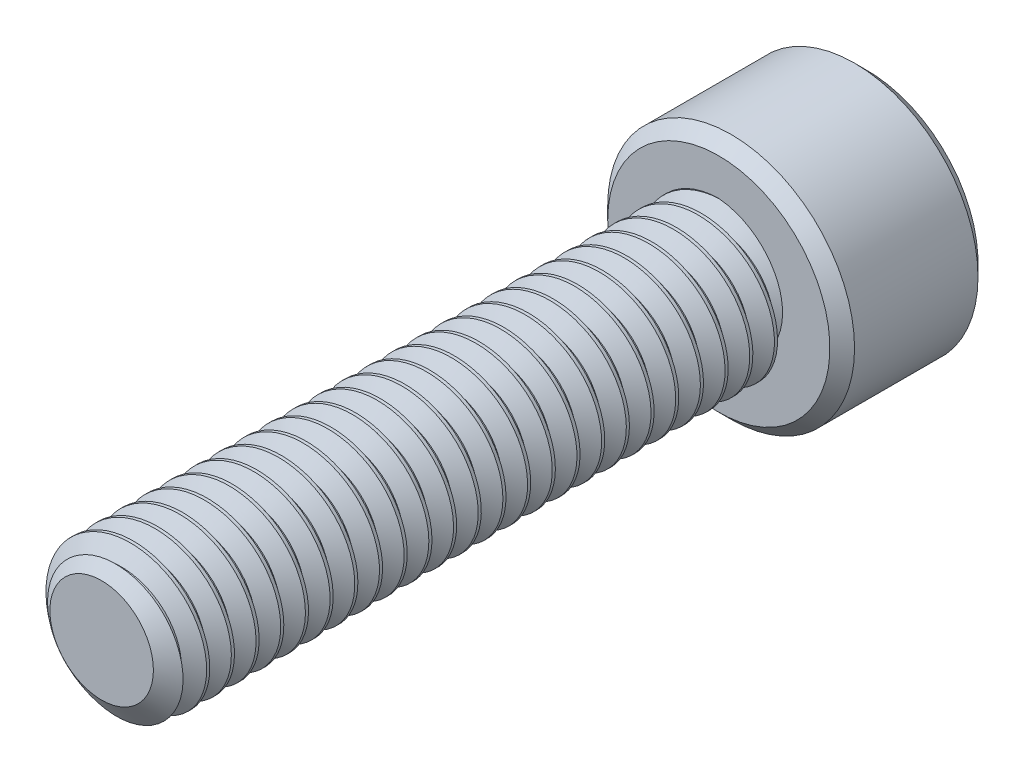
from build123d import *

# Parameters (mm, degrees)
SKETCH1_R          = 3
EXTRUDE1_DEPTH     = 25
CUT_SWEEP1_PITCH   = 1
SKETCH6_R          = 5
EXTRUDE2_DEPTH     = 6
CUT_EXTRUDE1_DEPTH = 3.75
CHAMFER1_SIZE      = 0.5


with BuildPart() as part:
    # Sketch1 → Extrude1 (new body)
    with BuildSketch(Plane.XY):
        Circle(SKETCH1_R)
    extrude(amount=-EXTRUDE1_DEPTH)

    # Cut-Sweep1: the profile of Sketch3 profile screwed along a right-hand helix of 26 turns, 6 arcs to a turn; built about Z, then put on its axis
    cut_sweep1_z = Axis((0, 0, 0), (0, 0, 1))
    cut_sweep1_corners = [(3.0003, 0, -0.875173205), (2.350480947, 0, -0.5), (2.350480947, 0, -0.375), (3.0003, 0, 0.000173205)]
    with BuildLine(mode=Mode.PRIVATE) as cut_sweep1_profile:
        Line(cut_sweep1_corners[0], cut_sweep1_corners[1])
        Line(cut_sweep1_corners[1], cut_sweep1_corners[2])
        Line(cut_sweep1_corners[2], cut_sweep1_corners[3])
        Line(cut_sweep1_corners[3], cut_sweep1_corners[0])
    cut_sweep1_cap = Face(cut_sweep1_profile.wire())
    cut_sweep1_turn_angles = [0, 30, 60, 90, 120, 150, 180, 210, 240, 270, 300, 330, 360]
    cut_sweep1_turn_weights = [1, 0.8660254037844387, 1, 0.8660254037844387, 1, 0.8660254037844387, 1, 0.8660254037844387, 1, 0.8660254037844387, 1, 0.8660254037844387, 1]
    cut_sweep1_turn_rails = [Edge.make_bspline([Vector(p[0], p[1], 0).rotate(cut_sweep1_z, cut_sweep1_turn_angles[k]) / cut_sweep1_turn_weights[k] + Vector(0, 0, p[2] + CUT_SWEEP1_PITCH * cut_sweep1_turn_angles[k] / 360) for k in range(13)], [0, 0, 0, 1, 1, 2, 2, 3, 3, 4, 4, 5, 5, 6, 6, 6], 2, cut_sweep1_turn_weights) for p in cut_sweep1_corners]
    cut_sweep1_turn_sides = [Face.make_surface_from_curves(cut_sweep1_turn_rails[p[0]], cut_sweep1_turn_rails[p[1]]) for p in [(0, 1), (1, 2), (2, 3), (3, 0)]]
    cut_sweep1 = Plane(origin=(0, 0, 0), x_dir=(0, 1, 0), z_dir=(0, 0, -1)) * Solid(Shell([*[p.moved(Location((0, 0, CUT_SWEEP1_PITCH * i))) for i in range(26) for p in cut_sweep1_turn_sides], cut_sweep1_cap, cut_sweep1_cap.rotate(cut_sweep1_z, 9360).moved(Location((0, 0, CUT_SWEEP1_PITCH * 9360 / 360)))]))
    add(cut_sweep1, mode=Mode.SUBTRACT)

    # Sketch4 → Cut-Revolve1 (revolve, cut)
    with BuildSketch(Plane(origin=(0, 0, 0), x_dir=(0, 0, -1), z_dir=(1, 0, 0)), mode=Mode.PRIVATE) as cut_revolve1_sk:
        Polygon((0.632650852, 3), (0, 2.096480947), (0, 3), align=None)
    revolve(cut_revolve1_sk.sketch.rotate(Axis((0, 0, 0), (0, 0, -1)), 244.349292568), axis=Axis((0, 0, 0), (0, 0, -1)), mode=Mode.SUBTRACT)

    # Sketch6 → Extrude2 (add)
    with BuildSketch(Plane(origin=(0, 0, -25), x_dir=(-1, 0, 0), z_dir=(0, 0, -1))):
        Circle(SKETCH6_R)
    extrude(amount=EXTRUDE2_DEPTH)

    # Sketch7 → Cut-Extrude1 (cut)
    with BuildSketch(Plane(origin=(0, 0, -31), x_dir=(-1, 0, 0), z_dir=(0, 0, -1))):
        Polygon((0, 2.886751346), (-2.5, 1.443375673), (-2.5, -1.443375673), (0, -2.886751346), (2.5, -1.443375673), (2.5, 1.443375673), align=None)
    extrude(amount=-CUT_EXTRUDE1_DEPTH, mode=Mode.SUBTRACT)

    # Cut-Extrude2 cone 1 section (through the dimple's axis) → Cut-Extrude2 (revolve, cut)
    with BuildSketch(Plane(origin=(0, 0, -31), x_dir=(0, 1, 0), z_dir=(1, 0, 0))):
        Polygon((0, 0), (2.886751346, 0), (0, 2.886751346), align=None)
    revolve(axis=Axis((0, 0, -31), (0, 0, 1)), mode=Mode.SUBTRACT)

    # Chamfer1
    chamfer1_edges = [part.edges().sort_by_distance(p)[0] for p in [
        (5, 0, -25),
        (5, 0, -31),
    ]]
    chamfer(chamfer1_edges, length=CHAMFER1_SIZE)


solid = part.part
